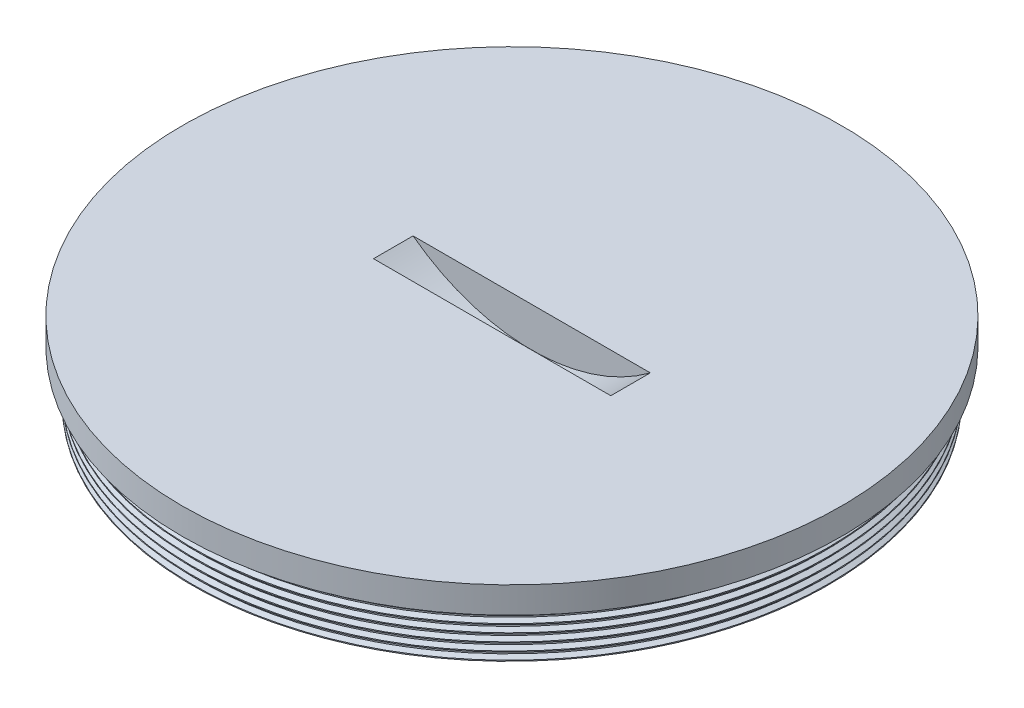
from build123d import *

# Parameters (mm, degrees)
SKETCH1_R                     = 23.8
BOSS_EXTRUDE1_DEPTH           = 12.7
MINCOLWIDTH_ONTRACKING1_PITCH = 0.6
CUT_EXTRUDE2_DEPTH            = 37.404703761
CUT_EXTRUDE2_DEPTH_BACK       = 37.404703761
SKETCH2_OUTSIDE_W             = 64.148
SKETCH2_OUTSIDE_H             = 29.048
SKETCH2_OUTSIDE_W_2           = 50
SKETCH2_OUTSIDE_H_2           = 3.81
SKETCH3_R                     = 25
BOSS_EXTRUDE2_DEPTH           = 2
CUT_EXTRUDE3_DEPTH            = 1.5
CUT_EXTRUDE3_DEPTH_BACK       = 1.5


with BuildPart() as part:
    # Sketch1 → Boss-Extrude1 (new body)
    with BuildSketch(Plane(origin=(0, 0, 0), x_dir=(1, 0, 0), z_dir=(0, 1, 0))):
        with Locations(Location((0, 0, 0), (0, 0, 270))):
            Circle(SKETCH1_R)
    extrude(amount=BOSS_EXTRUDE1_DEPTH)

    # MinColWidth_OnTracking1: the profile of HeaderRowsCount1 profile screwed along a right-hand helix of 21.166667 turns, 6 arcs to a turn; built about Z, then put on its axis
    mincolwidth_ontracking1_z = Axis((0, 0, 0), (0, 0, 1))
    mincolwidth_ontracking1_corners = [(23.7997, 0, -0.000173205), (24.124759525, 0, 0.187499999), (24.124759525, 0, 0.262499999), (23.7997, 0, 0.450173203)]
    with BuildLine(mode=Mode.PRIVATE) as mincolwidth_ontracking1_profile:
        Line(mincolwidth_ontracking1_corners[0], mincolwidth_ontracking1_corners[1])
        Line(mincolwidth_ontracking1_corners[1], mincolwidth_ontracking1_corners[2])
        Line(mincolwidth_ontracking1_corners[2], mincolwidth_ontracking1_corners[3])
        Line(mincolwidth_ontracking1_corners[3], mincolwidth_ontracking1_corners[0])
    mincolwidth_ontracking1_cap = Face(mincolwidth_ontracking1_profile.wire())
    mincolwidth_ontracking1_turn_angles = [0, 30, 60, 90, 120, 150, 180, 210, 240, 270, 300, 330, 360]
    mincolwidth_ontracking1_turn_weights = [1, 0.8660254037844387, 1, 0.8660254037844387, 1, 0.8660254037844387, 1, 0.8660254037844387, 1, 0.8660254037844387, 1, 0.8660254037844387, 1]
    mincolwidth_ontracking1_turn_rails = [Edge.make_bspline([Vector(p[0], p[1], 0).rotate(mincolwidth_ontracking1_z, mincolwidth_ontracking1_turn_angles[k]) / mincolwidth_ontracking1_turn_weights[k] + Vector(0, 0, p[2] + MINCOLWIDTH_ONTRACKING1_PITCH * mincolwidth_ontracking1_turn_angles[k] / 360) for k in range(13)], [0, 0, 0, 1, 1, 2, 2, 3, 3, 4, 4, 5, 5, 6, 6, 6], 2, mincolwidth_ontracking1_turn_weights) for p in mincolwidth_ontracking1_corners]
    mincolwidth_ontracking1_turn_sides = [Face.make_surface_from_curves(mincolwidth_ontracking1_turn_rails[p[0]], mincolwidth_ontracking1_turn_rails[p[1]]) for p in [(0, 1), (1, 2), (2, 3), (3, 0)]]
    mincolwidth_ontracking1_last_angles = [7560, 7590, 7620]
    mincolwidth_ontracking1_last_weights = [1, 0.8660254037844387, 1]
    mincolwidth_ontracking1_last_rails = [Edge.make_bspline([Vector(p[0], p[1], 0).rotate(mincolwidth_ontracking1_z, mincolwidth_ontracking1_last_angles[k]) / mincolwidth_ontracking1_last_weights[k] + Vector(0, 0, p[2] + MINCOLWIDTH_ONTRACKING1_PITCH * mincolwidth_ontracking1_last_angles[k] / 360) for k in range(3)], [0, 0, 0, 1, 1, 1], 2, mincolwidth_ontracking1_last_weights) for p in mincolwidth_ontracking1_corners]
    mincolwidth_ontracking1_last_sides = [Face.make_surface_from_curves(mincolwidth_ontracking1_last_rails[p[0]], mincolwidth_ontracking1_last_rails[p[1]]) for p in [(0, 1), (1, 2), (2, 3), (3, 0)]]
    mincolwidth_ontracking1 = Plane(origin=(0, 12.7, 0), x_dir=(-1, 0, 0), z_dir=(0, -1, 0)) * Solid(Shell([*[p.moved(Location((0, 0, MINCOLWIDTH_ONTRACKING1_PITCH * i))) for i in range(21) for p in mincolwidth_ontracking1_turn_sides], *mincolwidth_ontracking1_last_sides, mincolwidth_ontracking1_cap, mincolwidth_ontracking1_cap.rotate(mincolwidth_ontracking1_z, 7620).moved(Location((0, 0, MINCOLWIDTH_ONTRACKING1_PITCH * 7620 / 360)))]))
    add(mincolwidth_ontracking1)

    # Sketch2 outside → Cut-Extrude2 (cut, two sides: drawn at the far end of the back side and taken through both)
    with BuildSketch(Plane.XY.offset(-CUT_EXTRUDE2_DEPTH_BACK)):
        with Locations((0, 6.125)):
            Rectangle(SKETCH2_OUTSIDE_W, SKETCH2_OUTSIDE_H)
        with Locations((0, 6)):
            Rectangle(SKETCH2_OUTSIDE_W_2, SKETCH2_OUTSIDE_H_2, mode=Mode.SUBTRACT)
    extrude(amount=CUT_EXTRUDE2_DEPTH + CUT_EXTRUDE2_DEPTH_BACK, mode=Mode.SUBTRACT)

    # Sketch3 → Boss-Extrude2 (add)
    with BuildSketch(Plane(origin=(0, 7.905, 0), x_dir=(1, 0, 0), z_dir=(0, 1, 0))):
        with Locations(Location((0, 0, 0), (0, 0, 270))):
            Circle(SKETCH3_R)
    extrude(amount=BOSS_EXTRUDE2_DEPTH)

    # Sketch4 → Cut-Extrude3 (cut, two sides: drawn at the far end of the back side and taken through both)
    with BuildSketch(Plane.XY.offset(-CUT_EXTRUDE3_DEPTH_BACK)):
        with BuildLine():
            Line((-9, 9.905), (9, 9.905))
            ThreePointArc((9, 9.905), (0, 6.905), (-9, 9.905))
        make_face()
    extrude(amount=CUT_EXTRUDE3_DEPTH + CUT_EXTRUDE3_DEPTH_BACK, mode=Mode.SUBTRACT)


solid = part.part
